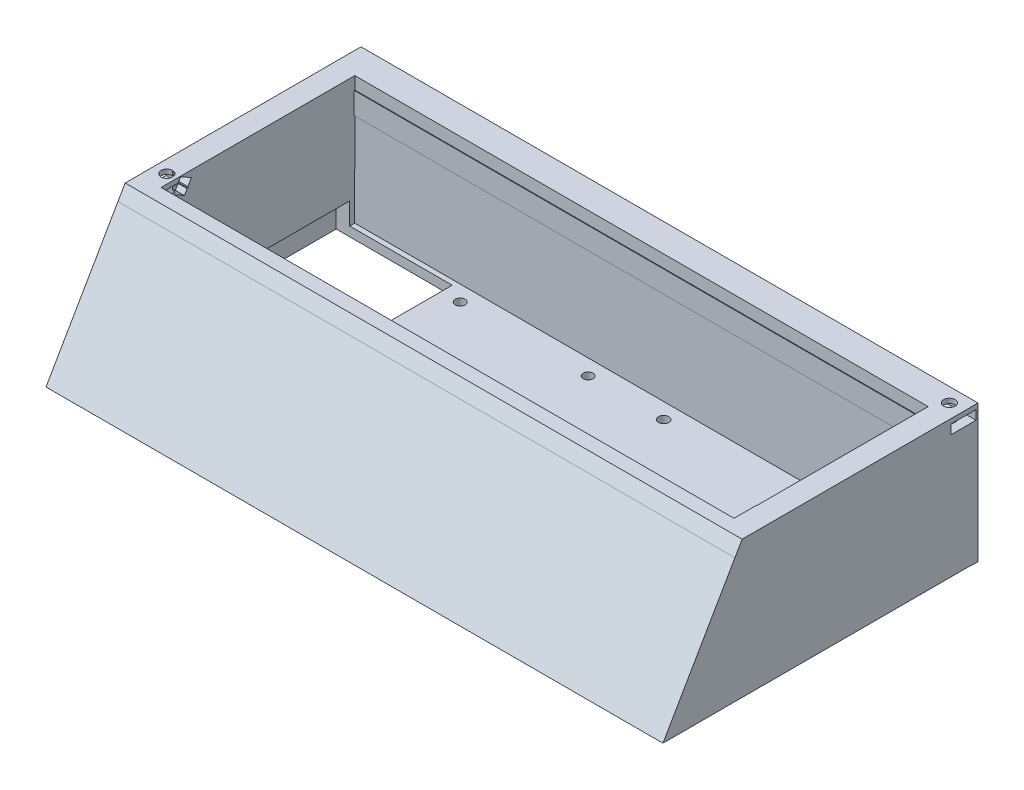
from build123d import *

# Parameters (mm, degrees)
BOSS_EXTRUDE1_DEPTH = 198
SHELL1_T            = -7
BOSS_EXTRUDE2_DEPTH = 191
SKETCH6_W           = 198
SKETCH6_H           = 40.103607498
BOSS_EXTRUDE4_DEPTH = 2
BOSS_EXTRUDE6_DEPTH = 198
SKETCH9_W           = 184
SKETCH9_H           = 55.057025978
CUT_EXTRUDE1_DEPTH  = 4
SKETCH10_W          = 191
SKETCH10_H          = 4.455271989
CUT_EXTRUDE2_DEPTH  = 4
SKETCH11_R          = 1.845894191
SKETCH11_R_2        = 1.836487246
CUT_EXTRUDE3_DEPTH  = 10
CUT_EXTRUDE4_DEPTH  = 10
CUT_EXTRUDE6_DEPTH  = 10
SKETCH16_W          = 183.884244201
SKETCH16_H          = 61.980598042
CUT_EXTRUDE7_DEPTH  = 15
SKETCH17_W          = 90.288181628
SKETCH17_H          = 3
BOSS_EXTRUDE7_DEPTH = 184
SKETCH18_R          = 1.585
SKETCH18_R_2        = 1.63212157
CUT_EXTRUDE8_DEPTH  = 10
SKETCH19_W          = 37.227708601
SKETCH19_H          = 62.195722112
CUT_EXTRUDE9_DEPTH  = 10
SKETCH20_W          = 158.187225577
SKETCH20_H          = 20.487778294
CUT_EXTRUDE12_DEPTH = 3
SKETCH21_W          = 118.225634496
SKETCH21_H          = 20.2676408
CUT_EXTRUDE13_DEPTH = 3
SKETCH22_R          = 1.585
CUT_EXTRUDE14_DEPTH = 17
SKETCH23_R          = 1.645057348
SKETCH23_R_2        = 1.569512845
SKETCH23_R_3        = 1.585
CUT_EXTRUDE15_DEPTH = 17


with BuildPart() as part:
    # Sketch1 → Boss-Extrude1 (new body)
    with BuildSketch(Plane(origin=(0, 0, 0), x_dir=(0, 0, -1), z_dir=(1, 0, 0))):
        Polygon((22.10846405, 0), (32.441807929, 17.899216821), (45.200737204, 39.99998538), (121.214199537, 39.99998538), (121.18, 0), align=None)
    extrude(amount=BOSS_EXTRUDE1_DEPTH)

    # Shell1
    shell1_openings = [part.faces().sort_by_distance(p)[0] for p in [
        (99, 0, -71.644232025),
    ]]
    offset(amount=SHELL1_T, openings=shell1_openings, kind=Kind.INTERSECTION)

    # Sketch2 → Boss-Extrude2 (add)
    with BuildSketch(Plane.ZY):
        Polygon((-30.191216521, 0), (-32.974854852, 0), (-52.025978727, 32.99998538), (-49.242340395, 32.99998538), align=None)
    extrude(amount=-BOSS_EXTRUDE2_DEPTH)

    # Sketch6 → Boss-Extrude4 (add)
    with BuildSketch(Plane(origin=(0, -0.10360746, -121.179911417), x_dir=(-1, 0, 0), z_dir=(0, -0.0008549884286730706, -0.9999996344973268))):
        with Locations((-99, 20.051803749)):
            Rectangle(SKETCH6_W, SKETCH6_H)
    extrude(amount=BOSS_EXTRUDE4_DEPTH)

    # Sketch8 → Boss-Extrude6 (add)
    with BuildSketch(Plane(origin=(198, 0, 0), x_dir=(0, 0, -1), z_dir=(1, 0, 0))):
        Polygon((123.214198806, 39.998275403), (123.214198806, 52.048275403), (52.157172812, 52.048275403), (45.200737204, 39.99998538), align=None)
    extrude(amount=-BOSS_EXTRUDE6_DEPTH)

    # Sketch9 → Cut-Extrude1 (cut)
    with BuildSketch(Plane(origin=(0, 40.000976116, -0.000876781), x_dir=(-1, 0, 0), z_dir=(0, -0.9999999997597789, 2.1918997334542923e-05))):
        with Locations((-99, 86.684544942)):
            Rectangle(SKETCH9_W, SKETCH9_H)
    extrude(amount=-CUT_EXTRUDE1_DEPTH, mode=Mode.SUBTRACT)

    # Sketch10 → Cut-Extrude2 (cut)
    with BuildSketch(Plane(origin=(0, -14.277996398, -24.732067017), x_dir=(-1, 0, 0), z_dir=(0, -0.49997192092444726, -0.8660416146393418))):
        with Locations((-99.604983797, 64.901002589)):
            Rectangle(SKETCH10_W, SKETCH10_H)
    extrude(amount=CUT_EXTRUDE2_DEPTH, mode=Mode.SUBTRACT)

    # Split4
    split(bisect_by=Plane(origin=(0, 44.000976115, -0.000964457), x_dir=(0, -2.191899733451847e-05, -0.9999999997597789), z_dir=(0, -0.9999999997597789, 2.191899733451847e-05)), keep=Keep.TOP)

    # Sketch11 → Cut-Extrude3 (cut)
    with BuildSketch(Plane(origin=(0, 44.000976115, -0.000964457), x_dir=(1, 0, 0), z_dir=(0, 0.9999999997597789, -2.1918997334518478e-05))):
        with Locations((4.122596141, 56.77218114)):
            Circle(SKETCH11_R)
        with Locations((193.378205815, 118.659575565)):
            Circle(SKETCH11_R_2)
    extrude(amount=-CUT_EXTRUDE3_DEPTH, mode=Mode.SUBTRACT)

    # Sketch13 → Cut-Extrude4 (cut)
    with BuildSketch(Plane.ZY):
        Polygon((-60.651506114, 42.499646715), (-52.651506116, 42.499822067), (-52.651506116, 39.499822067), (-60.651506114, 39.499646715), align=None)
    extrude(amount=-CUT_EXTRUDE4_DEPTH, mode=Mode.SUBTRACT)

    # Sketch15 → Cut-Extrude6 (cut)
    with BuildSketch(Plane(origin=(198, 0, 0), x_dir=(0, 0, -1), z_dir=(1, 0, 0))):
        Polygon((122.578470723, 42.498289338), (114.578470723, 42.49846469), (114.578470723, 39.515348921), (122.578470723, 39.515348921), align=None)
    extrude(amount=-CUT_EXTRUDE6_DEPTH, mode=Mode.SUBTRACT)

    # Sketch16 → Cut-Extrude7 (cut)
    with BuildSketch(Plane(origin=(0, 32.99998538, 0), x_dir=(-1, 0, 0), z_dir=(0, -1, 0))):
        with Locations((-98.942122101, 83.016277748)):
            Rectangle(SKETCH16_W, SKETCH16_H)
    extrude(amount=-CUT_EXTRUDE7_DEPTH, mode=Mode.SUBTRACT)

    # Sketch17 → Boss-Extrude7 (add)
    with BuildSketch(Plane.ZY.offset(-191)):
        with Locations((-73.246099444, 1.5)):
            Rectangle(SKETCH17_W, SKETCH17_H)
    extrude(amount=BOSS_EXTRUDE7_DEPTH)

    # Sketch18 → Cut-Extrude8 (cut)
    with BuildSketch(Plane.XZ):
        with Locations((186.291996716, -44.859873403)):
            Circle(SKETCH18_R)
        with Locations((11.705884172, -44.877084512)):
            Circle(SKETCH18_R_2)
    extrude(amount=-CUT_EXTRUDE8_DEPTH, mode=Mode.SUBTRACT)

    # Sketch19 → Cut-Extrude9 (cut)
    with BuildSketch(Plane.XZ):
        with Locations((21.273328451, -81.47744395)):
            Rectangle(SKETCH19_W, SKETCH19_H)
    cut_extrude9 = extrude(amount=-CUT_EXTRUDE9_DEPTH, mode=Mode.SUBTRACT)

    # Mirror1: Cut-Extrude9 across plane
    add(cut_extrude9.mirror(Plane(origin=(99, 0, 0), x_dir=(0, 0, 1), z_dir=(1, 0, 0))), mode=Mode.SUBTRACT)

    # Sketch20 → Cut-Extrude12 (cut)
    with BuildSketch(Plane.XZ):
        with Locations((98.431339013, -43.588440738)):
            Rectangle(SKETCH20_W, SKETCH20_H)
    extrude(amount=-CUT_EXTRUDE12_DEPTH, mode=Mode.SUBTRACT)

    # Sketch21 → Cut-Extrude13 (cut)
    with BuildSketch(Plane(origin=(0, 3, 0), x_dir=(1, 0, 0), z_dir=(0, 1, 0))):
        with Locations((99, 63.966150285)):
            Rectangle(SKETCH21_W, SKETCH21_H)
    extrude(amount=-CUT_EXTRUDE13_DEPTH, mode=Mode.SUBTRACT)

    # Sketch22 → Cut-Extrude14 (cut)
    with BuildSketch(Plane(origin=(0, 0, 0), x_dir=(-1, 0, 0), z_dir=(0, -1, 0))):
        with Locations((-152.093696712, 109.174789772)):
            Circle(SKETCH22_R)
    extrude(amount=-CUT_EXTRUDE14_DEPTH, mode=Mode.SUBTRACT)

    # Sketch23 → Cut-Extrude15 (cut)
    with BuildSketch(Plane.XZ):
        with Locations((111.158371466, -109.172867257)):
            Circle(SKETCH23_R)
        with Locations((86.919134313, -109.172867257)):
            Circle(SKETCH23_R_2)
        with Locations((45.863728734, -109.172867257)):
            Circle(SKETCH23_R_3)
    extrude(amount=-CUT_EXTRUDE15_DEPTH, mode=Mode.SUBTRACT)


solid = part.part
